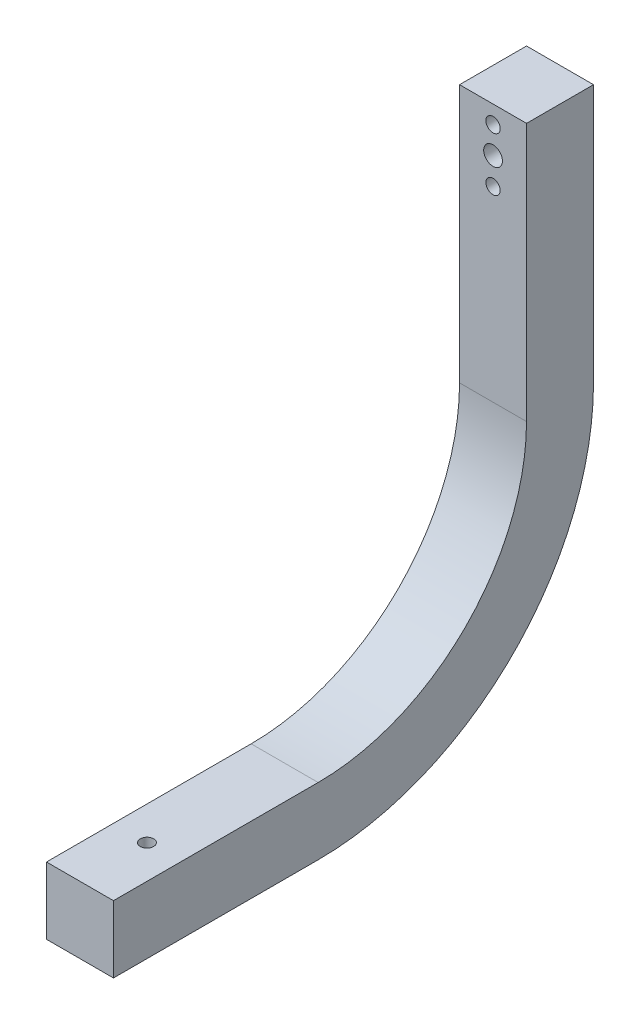
from build123d import *

# Parameters (mm, degrees)
BOSS_EXTRUDE1_DEPTH      = 7.5
BOSS_EXTRUDE1_DEPTH_BACK = 7.5
SKETCH3_R                = 1.5
CUT_EXTRUDE1_DEPTH       = 151.109126971
CUT_EXTRUDE2_DEPTH       = 144.536580703
CUT_EXTRUDE2_DEPTH_BACK  = 144.536580703
SKETCH4_R                = 2.1
SKETCH4_R_2              = 1.6
SKETCH5_R                = 2.275
CUT_EXTRUDE3_DEPTH       = 6
SKETCH6_R                = 3.825
CUT_EXTRUDE4_DEPTH       = 0.75


with BuildPart() as part:
    # Sketch1 → Boss-Extrude1 (new, two sides: drawn at the far end of the back side and taken through both)
    with BuildSketch(Plane(origin=(0, 0, 0), x_dir=(0, 0, -1), z_dir=(1, 0, 0)).offset(-BOSS_EXTRUDE1_DEPTH_BACK)):
        with BuildLine():
            Line((-15, 10), (0, 10))
            Line((0, 10), (0, -47.833333333))
            ThreePointArc((0, -47.833333333), (-18.061748493, -91.438251507), (-61.666666667, -109.5))
            Line((-61.666666667, -109.5), (-92.5, -109.5))
            Line((-92.5, -109.5), (-107.5, -109.5))
            Line((-107.5, -109.5), (-107.5, -94.5))
            Line((-107.5, -94.5), (-92.5, -94.5))
            Line((-92.5, -94.5), (-61.666666667, -94.5))
            ThreePointArc((-61.666666667, -94.5), (-28.668350211, -80.831649789), (-15, -47.833333333))
            Line((-15, -47.833333333), (-15, 10))
        make_face()
    extrude(amount=BOSS_EXTRUDE1_DEPTH + BOSS_EXTRUDE1_DEPTH_BACK)

    # Sketch3 → Cut-Extrude1 (cut, through all)
    with BuildSketch(Plane(origin=(0, -94.5, 0), x_dir=(1, 0, 0), z_dir=(0, 1, 0))):
        with Locations((0, -92.5)):
            Circle(SKETCH3_R)
    extrude(amount=-CUT_EXTRUDE1_DEPTH, mode=Mode.SUBTRACT)

    # Sketch4 → Cut-Extrude2 (cut, two sides: drawn at the far end of the back side and taken through both)
    with BuildSketch(Plane.XY.offset(15).offset(-CUT_EXTRUDE2_DEPTH_BACK)):
        Circle(SKETCH4_R)
        with Locations((0, 6)):
            Circle(SKETCH4_R_2)
        with Locations((0, -6)):
            Circle(SKETCH4_R_2)
    extrude(amount=CUT_EXTRUDE2_DEPTH + CUT_EXTRUDE2_DEPTH_BACK, mode=Mode.SUBTRACT)

    # Sketch5 → Cut-Extrude3 (cut)
    with BuildSketch(Plane.XZ.offset(109.5)):
        with Locations((0, 92.5)):
            Circle(SKETCH5_R)
    extrude(amount=-CUT_EXTRUDE3_DEPTH, mode=Mode.SUBTRACT)

    # Sketch6 → Cut-Extrude4 (cut)
    with BuildSketch(Plane.XZ.offset(109.5)):
        with Locations((0, 92.5)):
            Circle(SKETCH6_R)
    extrude(amount=-CUT_EXTRUDE4_DEPTH, mode=Mode.SUBTRACT)


solid = part.part
